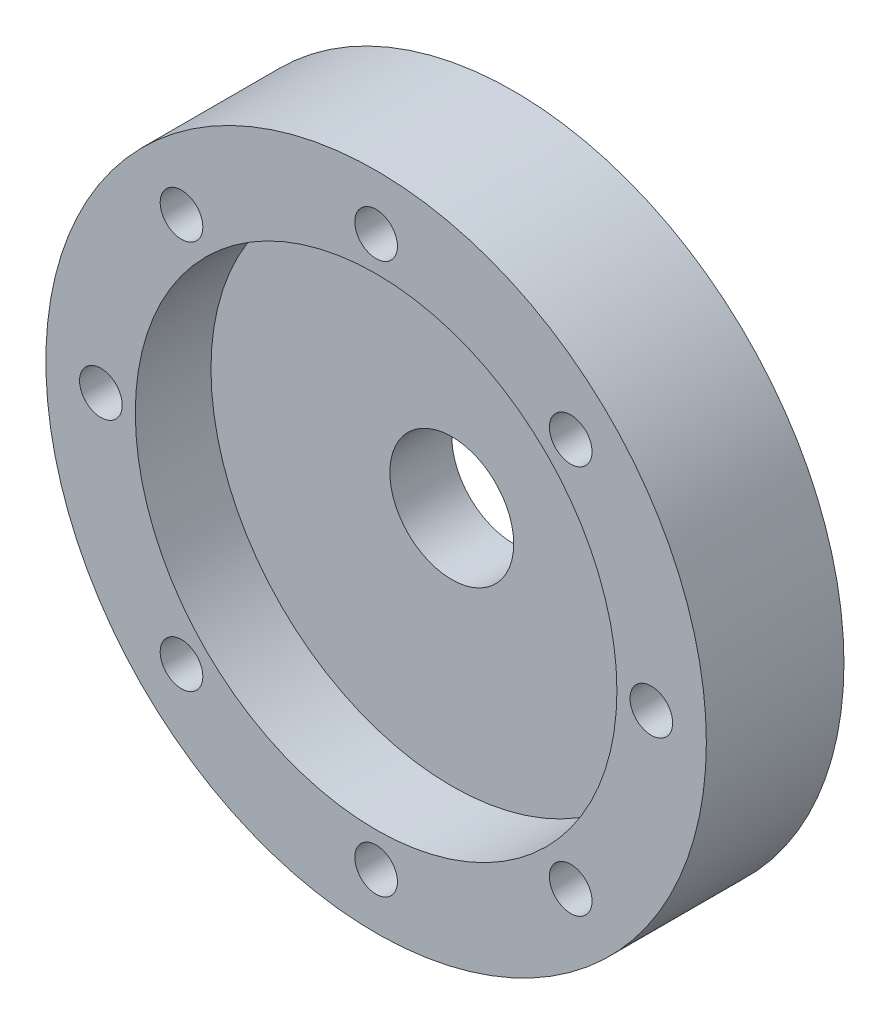
from build123d import *

# Parameters (mm, degrees)
SKETCH6_R           = 24
SKETCH6_R_2         = 1.55
SKETCH6_R_3         = 4.5
BOSS_EXTRUDE1_DEPTH = 10
SKETCH8_R           = 3.5
CUT_EXTRUDE6_DEPTH  = 4
SKETCH9_R           = 17.5
CUT_EXTRUDE7_DEPTH  = 5.5


with BuildPart() as part:
    # Sketch6 → Boss-Extrude1 (new body)
    with BuildSketch(Plane.XY):
        Circle(SKETCH6_R)
        with Locations((0, 20)):
            Circle(SKETCH6_R_2, mode=Mode.SUBTRACT)
        with Locations((14.142135624, 14.142135624)):
            Circle(SKETCH6_R_2, mode=Mode.SUBTRACT)
        with Locations((20, 0)):
            Circle(SKETCH6_R_2, mode=Mode.SUBTRACT)
        with Locations((14.142135624, -14.142135624)):
            Circle(SKETCH6_R_2, mode=Mode.SUBTRACT)
        with Locations((0, -20)):
            Circle(SKETCH6_R_2, mode=Mode.SUBTRACT)
        with Locations((-14.142135624, -14.142135624)):
            Circle(SKETCH6_R_2, mode=Mode.SUBTRACT)
        with Locations((-20, 0)):
            Circle(SKETCH6_R_2, mode=Mode.SUBTRACT)
        with Locations((-14.142135624, 14.142135624)):
            Circle(SKETCH6_R_2, mode=Mode.SUBTRACT)
        Circle(SKETCH6_R_3, mode=Mode.SUBTRACT)
    extrude(amount=BOSS_EXTRUDE1_DEPTH)

    # Sketch8 → Cut-Extrude6 (cut)
    with BuildSketch(Plane(origin=(0, 0, 0), x_dir=(-1, 0, 0), z_dir=(0, 0, -1))):
        with Locations((0, 20)):
            Circle(SKETCH8_R)
        with Locations((14.142135624, 14.142135624)):
            Circle(SKETCH8_R)
        with Locations((20, 0)):
            Circle(SKETCH8_R)
        with Locations((14.142135624, -14.142135624)):
            Circle(SKETCH8_R)
        with Locations((0, -20)):
            Circle(SKETCH8_R)
        with Locations((-14.142135624, -14.142135624)):
            Circle(SKETCH8_R)
        with Locations((-20, 0)):
            Circle(SKETCH8_R)
        with Locations((-14.142135624, 14.142135624)):
            Circle(SKETCH8_R)
    extrude(amount=-CUT_EXTRUDE6_DEPTH, mode=Mode.SUBTRACT)

    # Sketch9 → Cut-Extrude7 (cut)
    with BuildSketch(Plane.XY.offset(10)):
        Circle(SKETCH9_R)
    extrude(amount=-CUT_EXTRUDE7_DEPTH, mode=Mode.SUBTRACT)


solid = part.part
